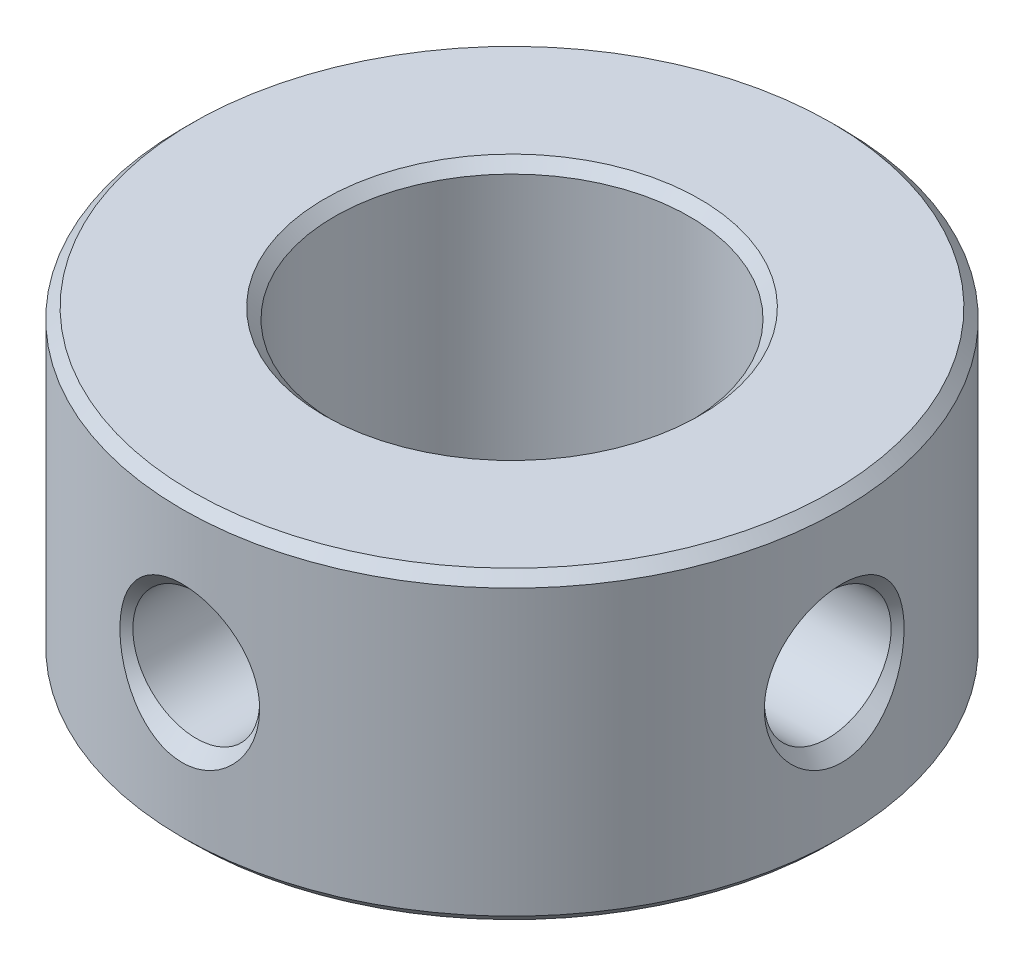
from build123d import *

# Parameters (mm, degrees)
PROFILES_R        = 6.5
PROFILES_R_2      = 3.5
PROFILE_DEPTH     = 3
CIRPATTERN1_COUNT = 2
CIRPATTERN1_ANGLE = 90
OUTERC_SIZE       = 0.2
INNERC_SIZE       = 0.2


# Read off the part's stored shape, not the designer's step:  Tapped Hole1
with BuildPart() as part:
    # ProfileS → Profile (new, symmetric)
    with BuildSketch(Plane(origin=(0, 0, 0), x_dir=(1, 0, 0), z_dir=(0, 1, 0))):
        with Locations(Location((0, 0, 0), (0, 0, 270))):
            Circle(PROFILES_R)
        with Locations(Location((0, 0, 0), (0, 0, 270))):
            Circle(PROFILES_R_2, mode=Mode.SUBTRACT)
    extrude(amount=PROFILE_DEPTH, both=True)

    # Tapped Hole1 outline → Tapped Hole1 (revolve, cut)
    with BuildSketch(Plane.XZ):
        Polygon((1.525000359, 6.500000359), (0, 6.500000359), (0, 3.269069771), (1.25, 3.269069771), (1.25, 6.225), align=None)
    tapped_hole1 = revolve(axis=Axis((0, 0, 0), (0, 0, 1)), mode=Mode.SUBTRACT)

    # CirPattern1: Tapped Hole1 ×2 about axis
    cirpattern1_axis = Axis((0, 3, 0), (0, 1, 0))
    for i in range(1, CIRPATTERN1_COUNT):
        add(tapped_hole1.rotate(cirpattern1_axis, i * CIRPATTERN1_ANGLE / (CIRPATTERN1_COUNT - 1)), mode=Mode.SUBTRACT)

    # OuterC
    outerc_edges = [part.edges().sort_by_distance(p)[0] for p in [
        (0, -3, -6.5),
        (0, 3, -6.5),
    ]]
    chamfer(outerc_edges, length=OUTERC_SIZE)

    # InnerC
    innerc_edges = [part.edges().sort_by_distance(p)[0] for p in [
        (0, -3, -3.5),
        (0, 3, -3.5),
    ]]
    chamfer(innerc_edges, length=INNERC_SIZE)


solid = part.part
